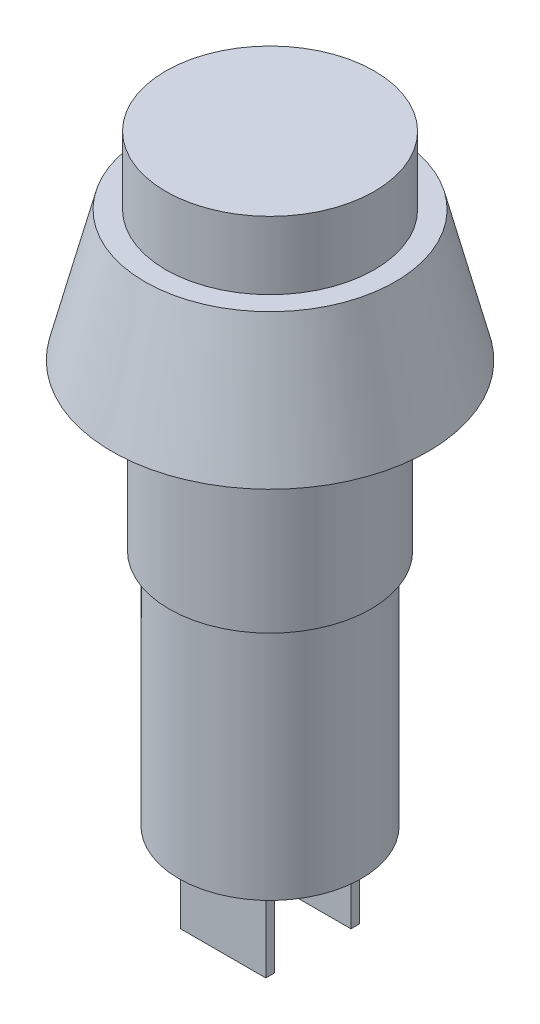
from build123d import *

# Parameters (mm, degrees)
SKETCH_6_R      = 6
EXTRUDE_3_DEPTH = 3.9
SKETCH_7_R      = 5.8
EXTRUDE_4_DEPTH = 9.5
SKETCH_8_R      = 5.25
EXTRUDE_5_DEPTH = 13.7
SKETCH_9_W      = 4.89861288
SKETCH_9_H      = 0.5003769
SKETCH_9_H_2    = 0.495607413
EXTRUDE_6_DEPTH = 5


with BuildPart() as part:
    # Эскиз5 → Повернуть1 (revolve)
    with BuildSketch(Plane.XY):
        Polygon((-7.2, 7.5), (-9.1, 0), (0, 0), (0, 7.5), align=None)
    revolve(axis=Axis((0, 0, 0), (0, 1, 0)))

    # Эскиз6 → Бобышка-Вытянуть3 (add)
    with BuildSketch(Plane(origin=(0, 7.5, 0), x_dir=(1, 0, 0), z_dir=(0, 1, 0))):
        Circle(SKETCH_6_R)
    extrude(amount=EXTRUDE_3_DEPTH)

    # Эскиз7 → Бобышка-Вытянуть4 (add)
    with BuildSketch(Plane.XZ):
        Circle(SKETCH_7_R)
    extrude(amount=EXTRUDE_4_DEPTH)

    # Эскиз8 → Бобышка-Вытянуть5 (add)
    with BuildSketch(Plane.XZ.offset(9.5)):
        Circle(SKETCH_8_R)
    extrude(amount=EXTRUDE_5_DEPTH)

    # Эскиз9 → Бобышка-Вытянуть6 (add)
    with BuildSketch(Plane(origin=(0, -23.2, 0), x_dir=(-1, 0, 0), z_dir=(0, -1, 0))):
        with Locations((-0.000422971, 2.45018845)):
            Rectangle(SKETCH_9_W, SKETCH_9_H)
        with Locations((-0.000422971, -2.447803707)):
            Rectangle(SKETCH_9_W, SKETCH_9_H_2)
    extrude(amount=EXTRUDE_6_DEPTH)


solid = part.part
